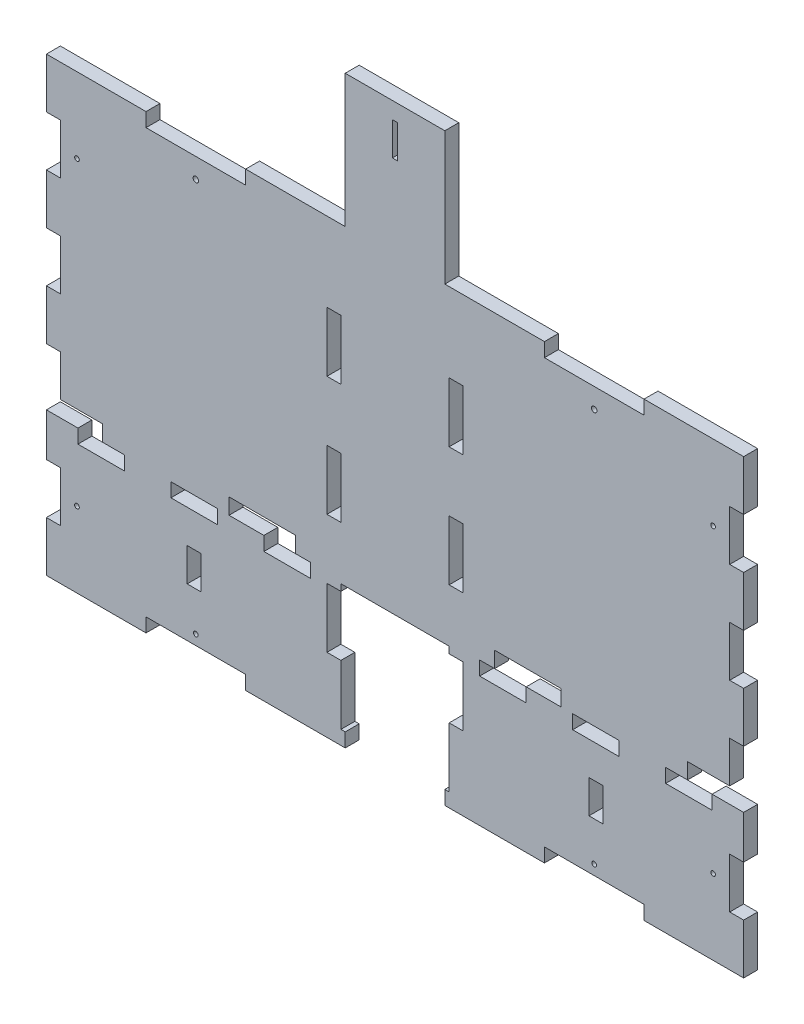
from build123d import *

# Parameters (mm, degrees)
SKETCH1_W           = 266.7
SKETCH1_H           = 172.72
BOSS_EXTRUDE1_DEPTH = 5.334
SKETCH2_W           = 38.1
SKETCH2_H           = 5.334
CUT_EXTRUDE1_DEPTH  = 165.701204222
SKETCH5_W           = 25.4
SKETCH5_H           = 6.096
SKETCH5_W_2         = 21.477624924
SKETCH5_W_3         = 21.477624925
CUT_EXTRUDE3_DEPTH  = 165.701204222
SKETCH9_W           = 5.334
SKETCH9_H           = 19.191111111
CUT_EXTRUDE7_DEPTH  = 165.701204222
SKETCH10_W          = 38.1
SKETCH10_H          = 5.334
BOSS_EXTRUDE2_DEPTH = 50.8
SKETCH11_W          = 6.604
SKETCH11_H          = 40.64
CUT_EXTRUDE8_DEPTH  = 197.710659379
SKETCH12_R          = 3.81
CUT_EXTRUDE9_DEPTH  = 197.710659379
SKETCH15_W          = 6.604
SKETCH15_H          = 10.16
CUT_EXTRUDE12_DEPTH = 197.710659379
SKETCH18_W          = 38.1
SKETCH18_H          = 56.134
BOSS_EXTRUDE3_DEPTH = 5.334
SKETCH19_W          = 34.756768033
SKETCH19_H          = 54.94363668
CUT_EXTRUDE15_DEPTH = 197.710659379
SKETCH21_R          = 0.889
CUT_EXTRUDE17_DEPTH = 197.710659379
SKETCH23_R          = 1.04775
CUT_EXTRUDE19_DEPTH = 197.710659379
SKETCH25_W          = 17.78
SKETCH25_H          = 5.334
CUT_EXTRUDE20_DEPTH = 197.710659379
SKETCH26_W          = 5.334
SKETCH26_H          = 12.7
CUT_EXTRUDE21_DEPTH = 197.710659379
SKETCH27_W          = 41.402
SKETCH27_H          = 48.26
CUT_EXTRUDE22_DEPTH = 197.710659379
SKETCH28_W          = 5.334
SKETCH28_H          = 22.86
CUT_EXTRUDE23_DEPTH = 197.710659379
SKETCH29_R          = 0.889
CUT_EXTRUDE24_DEPTH = 197.710659379
SKETCH30_W          = 2.032
SKETCH30_H          = 12.7
CUT_EXTRUDE25_DEPTH = 197.710659379


with BuildPart() as part:
    # Sketch1 → Boss-Extrude1 (new body)
    with BuildSketch(Plane.XY):
        with Locations((5.474099752, 2.104142138)):
            Rectangle(SKETCH1_W, SKETCH1_H)
    extrude(amount=BOSS_EXTRUDE1_DEPTH)

    # Sketch2 → Cut-Extrude1 (cut, through all)
    with BuildSketch(Plane.XY.offset(5.334)):
        with Locations((-70.725900248, -81.588857862)):
            Rectangle(SKETCH2_W, SKETCH2_H)
        with Locations((5.474099752, -81.588857862)):
            Rectangle(SKETCH2_W, SKETCH2_H)
        with Locations((81.674099752, -81.588857862)):
            Rectangle(SKETCH2_W, SKETCH2_H)
        with Locations((81.674099752, 85.797142138)):
            Rectangle(SKETCH2_W, SKETCH2_H)
        with Locations((5.474099752, 85.797142138)):
            Rectangle(SKETCH2_W, SKETCH2_H)
        with Locations((-70.725900248, 85.797142138)):
            Rectangle(SKETCH2_W, SKETCH2_H)
    extrude(amount=-CUT_EXTRUDE1_DEPTH, mode=Mode.SUBTRACT)

    # Sketch5 → Cut-Extrude3 (cut, through all)
    with BuildSketch(Plane.XY.offset(5.334)):
        with Locations((56.274099752, -26.343857862)):
            Rectangle(SKETCH5_W, SKETCH5_H)
        with Locations((-45.325900248, -26.343857862)):
            Rectangle(SKETCH5_W, SKETCH5_H)
        with Locations((-117.137087786, -26.343857862)):
            Rectangle(SKETCH5_W_2, SKETCH5_H)
        with Locations((128.08528729, -26.343857862)):
            Rectangle(SKETCH5_W_3, SKETCH5_H)
    extrude(amount=-CUT_EXTRUDE3_DEPTH, mode=Mode.SUBTRACT)

    # Sketch9 → Cut-Extrude7 (cut, through all)
    with BuildSketch(Plane.XY.offset(5.334)):
        with Locations((-125.208900248, -55.469191196)):
            Rectangle(SKETCH9_W, SKETCH9_H)
        with Locations((-125.208900248, -17.086968973)):
            Rectangle(SKETCH9_W, SKETCH9_H)
        with Locations((-125.208900248, 21.295253249)):
            Rectangle(SKETCH9_W, SKETCH9_H)
        with Locations((-125.208900248, 59.677475472)):
            Rectangle(SKETCH9_W, SKETCH9_H)
        with Locations((136.157099752, 59.677475472)):
            Rectangle(SKETCH9_W, SKETCH9_H)
        with Locations((136.157099752, 21.295253249)):
            Rectangle(SKETCH9_W, SKETCH9_H)
        with Locations((136.157099752, -17.086968973)):
            Rectangle(SKETCH9_W, SKETCH9_H)
        with Locations((136.157099752, -55.469191196)):
            Rectangle(SKETCH9_W, SKETCH9_H)
    extrude(amount=-CUT_EXTRUDE7_DEPTH, mode=Mode.SUBTRACT)

    # Sketch10 → Boss-Extrude2 (add)
    with BuildSketch(Plane(origin=(0, 88.464142138, 0), x_dir=(1, 0, 0), z_dir=(0, 1, 0))):
        with Locations((43.574099752, -2.667)):
            Rectangle(SKETCH10_W, SKETCH10_H)
    extrude(amount=BOSS_EXTRUDE2_DEPTH)

    # Sketch11 → Cut-Extrude8 (cut, through all)
    with BuildSketch(Plane(origin=(0, 0, 0), x_dir=(-1, 0, 0), z_dir=(0, 0, -1))):
        with Locations((-27.826099752, 108.784142138)):
            Rectangle(SKETCH11_W, SKETCH11_H)
    extrude(amount=-CUT_EXTRUDE8_DEPTH, mode=Mode.SUBTRACT)

    # Sketch12 → Cut-Extrude9 (cut, through all)
    with BuildSketch(Plane.XY.offset(5.334)):
        with Locations((43.574099752, 130.476471297)):
            Circle(SKETCH12_R)
    extrude(amount=-CUT_EXTRUDE9_DEPTH, mode=Mode.SUBTRACT)

    # Sketch15 → Cut-Extrude12 (cut, through all)
    with BuildSketch(Plane.XY.offset(5.334)):
        with Locations((27.826099752, 134.184142138)):
            Rectangle(SKETCH15_W, SKETCH15_H)
    extrude(amount=-CUT_EXTRUDE12_DEPTH, mode=Mode.SUBTRACT)

    # Sketch18 → Boss-Extrude3 (add)
    with BuildSketch(Plane.XY.offset(5.334)):
        with Locations((5.474099752, 111.197142138)):
            Rectangle(SKETCH18_W, SKETCH18_H)
    extrude(amount=-BOSS_EXTRUDE3_DEPTH)

    # Sketch19 → Cut-Extrude15 (cut, through all)
    with BuildSketch(Plane.XY.offset(5.334)):
        with Locations((48.506483768, 115.935960478)):
            Rectangle(SKETCH19_W, SKETCH19_H)
    extrude(amount=-CUT_EXTRUDE15_DEPTH, mode=Mode.SUBTRACT)

    # Sketch21 → Cut-Extrude17 (cut, through all)
    with BuildSketch(Plane.XY.offset(5.334)):
        with Locations((127.140099752, 59.677475471)):
            Circle(SKETCH21_R)
        with Locations((-116.191900248, 59.677475471)):
            Circle(SKETCH21_R)
        with Locations((-116.191900248, -55.469191196)):
            Circle(SKETCH21_R)
        with Locations((127.140099752, -55.469191196)):
            Circle(SKETCH21_R)
    extrude(amount=-CUT_EXTRUDE17_DEPTH, mode=Mode.SUBTRACT)

    # Sketch23 → Cut-Extrude19 (cut, through all)
    with BuildSketch(Plane(origin=(0, 0, 0), x_dir=(-1, 0, 0), z_dir=(0, 0, -1))):
        with Locations((-81.674099752, 75.510142138)):
            Circle(SKETCH23_R)
        with Locations((70.725900248, 75.510142138)):
            Circle(SKETCH23_R)
    extrude(amount=-CUT_EXTRUDE19_DEPTH, mode=Mode.SUBTRACT)

    # Sketch25 → Cut-Extrude20 (cut, through all)
    with BuildSketch(Plane(origin=(0, 0, 0), x_dir=(-1, 0, 0), z_dir=(0, 0, -1))):
        with Locations((-117.869099752, -32.058857862)):
            Rectangle(SKETCH25_W, SKETCH25_H)
        with Locations((-82.309099752, -32.058857862)):
            Rectangle(SKETCH25_W, SKETCH25_H)
        with Locations((-46.749099752, -32.058857862)):
            Rectangle(SKETCH25_W, SKETCH25_H)
        with Locations((35.800900248, -32.058857862)):
            Rectangle(SKETCH25_W, SKETCH25_H)
        with Locations((106.920900248, -32.058857862)):
            Rectangle(SKETCH25_W, SKETCH25_H)
        with Locations((71.360900248, -32.058857862)):
            Rectangle(SKETCH25_W, SKETCH25_H)
    extrude(amount=-CUT_EXTRUDE20_DEPTH, mode=Mode.SUBTRACT)

    # Sketch26 → Cut-Extrude21 (cut, through all)
    with BuildSketch(Plane(origin=(0, 0, 0), x_dir=(-1, 0, 0), z_dir=(0, 0, -1))):
        with Locations((-82.309099752, -53.775857862)):
            Rectangle(SKETCH26_W, SKETCH26_H)
        with Locations((71.360900248, -53.775857862)):
            Rectangle(SKETCH26_W, SKETCH26_H)
    extrude(amount=-CUT_EXTRUDE21_DEPTH, mode=Mode.SUBTRACT)

    # Sketch27 → Cut-Extrude22 (cut, through all)
    with BuildSketch(Plane(origin=(0, 0, 0), x_dir=(-1, 0, 0), z_dir=(0, 0, -1))):
        with Locations((-5.474099752, -54.791857862)):
            Rectangle(SKETCH27_W, SKETCH27_H)
    extrude(amount=-CUT_EXTRUDE22_DEPTH, mode=Mode.SUBTRACT)

    # Sketch28 → Cut-Extrude23 (cut, through all)
    with BuildSketch(Plane(origin=(0, 0, 0), x_dir=(-1, 0, 0), z_dir=(0, 0, -1))):
        with Locations((-28.842099752, -44.631857862)):
            Rectangle(SKETCH28_W, SKETCH28_H)
        with Locations((-28.842099752, 1.088142138)):
            Rectangle(SKETCH28_W, SKETCH28_H)
        with Locations((-28.842099752, 46.808142138)):
            Rectangle(SKETCH28_W, SKETCH28_H)
        with Locations((17.893900248, 46.808142138)):
            Rectangle(SKETCH28_W, SKETCH28_H)
        with Locations((17.893900248, 1.088142138)):
            Rectangle(SKETCH28_W, SKETCH28_H)
        with Locations((17.893900248, -44.631857862)):
            Rectangle(SKETCH28_W, SKETCH28_H)
    extrude(amount=-CUT_EXTRUDE23_DEPTH, mode=Mode.SUBTRACT)

    # Sketch29 → Cut-Extrude24 (cut, through all)
    with BuildSketch(Plane(origin=(0, 0, 0), x_dir=(-1, 0, 0), z_dir=(0, 0, -1))):
        with Locations((-81.674099752, -75.111857862)):
            Circle(SKETCH29_R)
        with Locations((70.725900248, -75.111857862)):
            Circle(SKETCH29_R)
    extrude(amount=-CUT_EXTRUDE24_DEPTH, mode=Mode.SUBTRACT)

    # Sketch30 → Cut-Extrude25 (cut, through all)
    with BuildSketch(Plane(origin=(0, 0, 0), x_dir=(-1, 0, 0), z_dir=(0, 0, -1))):
        with Locations((-5.474099752, 126.564142138)):
            Rectangle(SKETCH30_W, SKETCH30_H)
    extrude(amount=-CUT_EXTRUDE25_DEPTH, mode=Mode.SUBTRACT)


solid = part.part
